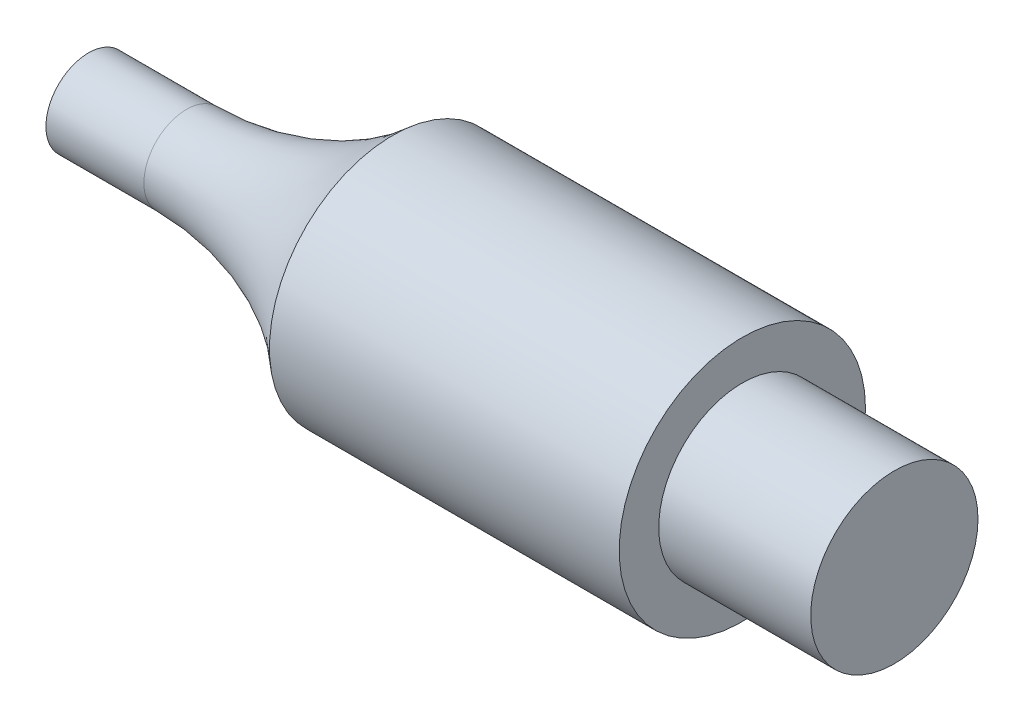
from build123d import *

# Parameters (mm, degrees)
SKETCH_1_W   = 5
SKETCH_1_H   = 2.75
SKETCH_1_3_W = 10
SKETCH_1_3_H = 1.401405784
FILLET_1_R   = 10


with BuildPart() as part:
    # 草图1 → 旋转1 (revolve)
    with BuildSketch(Plane(origin=(0, 0, 0), x_dir=(1, 0, 0), z_dir=(0, 1, 0))):
        Polygon((-26.94244556, -1.725), (-15.44244556, -1.725), (-15.44244556, 1.025), (-15.44244556, 2.325), (-26.94244556, 2.325), (-26.94244556, -0.323594216), align=None)
        with Locations((-12.94244556, -0.35)):
            Rectangle(SKETCH_1_W, SKETCH_1_H)
    revolve(axis=Axis((-10.44244556, 0, 1.725), (-1, 0, 0)))

    # 草图1<3> → 旋转2 (revolve)
    with BuildSketch(Plane(origin=(0, 0, 0), x_dir=(1, 0, 0), z_dir=(0, 1, 0))):
        with Locations((-31.94244556, -1.024297108)):
            Rectangle(SKETCH_1_3_W, SKETCH_1_3_H)
    revolve(axis=Axis((-10.44244556, 0, 1.725), (-1, 0, 0)))

    # 圆角1
    # the kernel refuses this fillet: 10 mm, written as the material it adds along each edge
    with BuildSketch(Plane(origin=(-26.94244556, 0, 1.725), x_dir=(0, 0, -1), z_dir=(0, 1, 0))) as fillet_1_piece_1:
        with BuildLine():
            CenterArc((11.401405784, 6.779146923), FILLET_1_R, 180, 42.680903871)
            Line((1.401405784, 6.779146923), (1.201405784, 6.779146923))
            Line((1.201405784, 6.779146923), (1.201405784, 0))
            Line((1.201405784, 0), (1.401405784, -0.2))
            ThreePointArc((1.401405784, -0.2), (2.725702892, -0.2), (3.902971884, -0.135582938))
            Line((3.902971884, -0.135582938), (4.05, 0))
        make_face()
    revolve(axis=Axis((-26.94244556, 0, 1.725), (-1, 0, 0)))


solid = part.part
